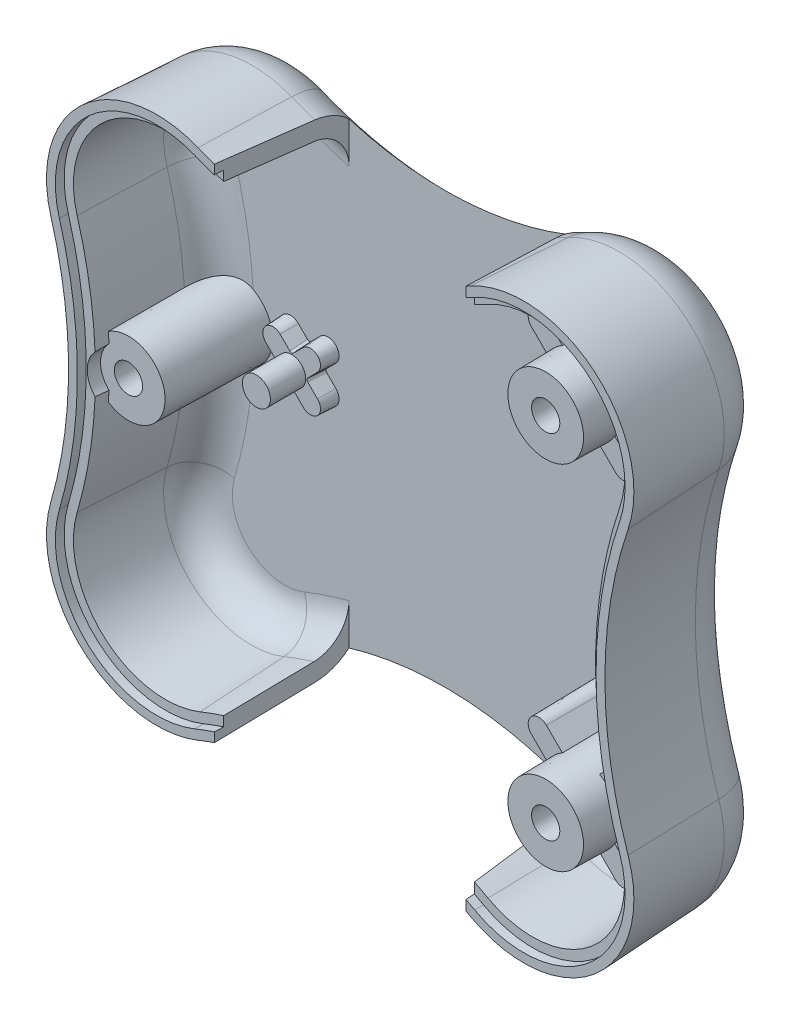
from build123d import *

# Parameters (mm, degrees)
BOSS_EXTRUDE1_DEPTH           = 16.5
BOSS_EXTRUDE1_DRAFT           = -3
FILLET1_R                     = 6
SHELL1_T                      = -2
SKETCH3_W                     = 27
SKETCH3_H                     = 29
CUT_EXTRUDE1_DEPTH            = 55.25
SKETCH4_R                     = 4.5
BOSS_EXTRUDE2_DEPTH           = 12
BOSS_EXTRUDE2_DRAFT           = 1
BOSS_EXTRUDE2_PROFILE_2_DEPTH = 12
BOSS_EXTRUDE2_PROFILE_2_DRAFT = 1
BOSS_EXTRUDE9_REACH           = 50.588
SKETCH16_R                    = 4.15
BOSS_EXTRUDE9_DRAFT           = 1
BOSS_EXTRUDE3_DEPTH           = 8
BOSS_EXTRUDE3_DRAFT           = 1
CIRPATTERN1_COPY_1_DEPTH      = 8
CIRPATTERN1_COPY_1_DRAFT      = 1
CIRPATTERN1_COPY_2_DEPTH      = 8
CIRPATTERN1_COPY_2_DRAFT      = 1
CIRPATTERN1_COPY_3_DEPTH      = 8
CIRPATTERN1_COPY_3_DRAFT      = 1
MIRROR1_COPY_1_DEPTH          = 8
MIRROR1_COPY_1_DRAFT          = 1
MIRROR1_COPY_2_DEPTH          = 8
MIRROR1_COPY_2_DRAFT          = 1
MIRROR1_COPY_3_DEPTH          = 8
MIRROR1_COPY_3_DRAFT          = 1
MIRROR1_COPY_4_DEPTH          = 8
MIRROR1_COPY_4_DRAFT          = 1
SKETCH17_R                    = 3.75
CUT_EXTRUDE7_DEPTH            = 11
CUT_EXTRUDE7_DRAFT            = -3
CUT_EXTRUDE7_PROFILE_2_DEPTH  = 11
CUT_EXTRUDE7_PROFILE_2_DRAFT  = -3
CUT_EXTRUDE7_PROFILE_3_DEPTH  = 11
CUT_EXTRUDE7_PROFILE_3_DRAFT  = -3
SKETCH18_R                    = 1.6
CUT_EXTRUDE8_DEPTH            = 11
CUT_EXTRUDE9_DEPTH            = 1
SKETCH19_R                    = 3.175
CUT_EXTRUDE10_DEPTH           = 3
SKETCH10_R                    = 1.5875
BOSS_EXTRUDE6_DEPTH           = 6
SKETCH11_W                    = 27
SKETCH11_H                    = 80.821969152
CUT_EXTRUDE5_DEPTH            = 49.734693521
CUT_EXTRUDE5_DRAFT            = -3
BOSS_EXTRUDE7_DEPTH           = 2
BOSS_EXTRUDE7_TAPER           = 3
CIRPATTERN2_COUNT             = 4
FILLET3_R                     = 0.3


with BuildPart() as part:
    # Sketch2 → Boss-Extrude1 (with draft: the straight prism first)
    with BuildSketch(Plane.XY):
        with BuildLine():
            ThreePointArc((32.637919282, -16), (30.008796412, 0), (32.637919282, 16))
            ThreePointArc((32.637919282, 16), (28.812030199, 29.590643021), (14.758307371, 30.945589403))
            ThreePointArc((14.758307371, 30.945589403), (-0.467881352, 26.53374904), (-16.112917371, 29.0899193))
            ThreePointArc((-16.112917371, 29.0899193), (-29.180524263, 26.770185381), (-32.7952, 14))
            ThreePointArc((-32.7952, 14), (-30.7952, 0), (-32.7952, -14))
            ThreePointArc((-32.7952, -14), (-29.180524263, -26.770185381), (-16.112917371, -29.0899193))
            ThreePointArc((-16.112917371, -29.0899193), (-0.467881352, -26.53374904), (14.758307371, -30.945589403))
            ThreePointArc((14.758307371, -30.945589403), (28.812030199, -29.590643021), (32.637919282, -16))
        make_face()
    extrude(amount=-BOSS_EXTRUDE1_DEPTH)
    # Boss-Extrude1: the draft: its side faces are tilted about the plane it starts from
    boss_extrude1_sides = [part.faces().sort_by_distance(p)[0] for p in [
        (-0.467881352, -26.53374904, -8.25),
        (28.812030199, -29.590643021, -8.25),
        (30.008796412, 0, -8.25),
        (28.812030199, 29.590643021, -8.25),
        (-0.467881352, 26.53374904, -8.25),
        (-29.180524263, 26.770185381, -8.25),
        (-30.7952, 0, -8.25),
        (-29.180524263, -26.770185381, -8.25),
    ]]
    draft(boss_extrude1_sides, Plane.XY, BOSS_EXTRUDE1_DRAFT)

    # Fillet1
    fillet1_edges = [part.edges().sort_by_distance(p)[0] for p in [
        (-0.415996161, 25.670578685, -16.5),
        (-28.600442049, 26.128890006, -16.5),
        (-29.930471642, 0, -16.5),
        (-28.600442049, -26.128890006, -16.5),
        (-0.415996161, -25.670578685, -16.5),
        (28.257439765, -28.927178942, -16.5),
        (29.144068053, 0, -16.5),
        (28.257439765, 28.927178942, -16.5),
    ]]
    fillet(fillet1_edges, radius=FILLET1_R)

    # Shell1
    shell1_openings = [part.faces().sort_by_distance(p)[0] for p in [
        (0.470160024, 0, 0),
    ]]
    offset(amount=SHELL1_T, openings=shell1_openings, kind=Kind.INTERSECTION)

    # Sketch3 → Cut-Extrude1 (cut, symmetric)
    with BuildSketch(Plane(origin=(0, 0, 0), x_dir=(1, 0, 0), z_dir=(0, 1, 0))):
        Rectangle(SKETCH3_W, SKETCH3_H)
    extrude(amount=CUT_EXTRUDE1_DEPTH, both=True, mode=Mode.SUBTRACT)


with BuildPart() as boss_extrude2_tool:
    # Sketch4 → Boss-Extrude2 (with draft: the straight prism first)
    with BuildSketch(Plane.XY.offset(-14.5)):
        with Locations((20.7952, 20)):
            Circle(SKETCH4_R)
    extrude(amount=BOSS_EXTRUDE2_DEPTH)
    # Boss-Extrude2: the draft: its side faces are tilted about the plane it starts from
    boss_extrude2_sides = [boss_extrude2_tool.faces().sort_by_distance(p)[0] for p in [
        (16.2952, 20, -8.5),
    ]]
    draft(boss_extrude2_sides, Plane.XY.offset(-14.5), BOSS_EXTRUDE2_DRAFT)


with BuildPart() as part_1:
    add(part.part)

    # Boss-Extrude2: add boss_extrude2_tool
    add(boss_extrude2_tool.part)


with BuildPart() as boss_extrude2_profile_2_tool:
    # Sketch4 → Boss-Extrude2 profile 2 (with draft: the straight prism first)
    with BuildSketch(Plane.XY.offset(-14.5)):
        with Locations((20.7952, -20)):
            Circle(SKETCH4_R)
    extrude(amount=BOSS_EXTRUDE2_PROFILE_2_DEPTH)
    # Boss-Extrude2 profile 2: the draft: its side faces are tilted about the plane it starts from
    boss_extrude2_profile_2_sides = [boss_extrude2_profile_2_tool.faces().sort_by_distance(p)[0] for p in [
        (16.2952, -20, -8.5),
    ]]
    draft(boss_extrude2_profile_2_sides, Plane.XY.offset(-14.5), BOSS_EXTRUDE2_PROFILE_2_DRAFT)


with BuildPart() as part_2:
    add(part_1.part)

    # Boss-Extrude2 profile 2: add boss_extrude2_profile_2_tool
    add(boss_extrude2_profile_2_tool.part)




with BuildPart() as boss_extrude9_long_prism_1:
    # Sketch16 → Boss-Extrude9 (the long prism of profile 1, to be tilted and cut off)
    with BuildSketch(Plane.XY.offset(-2.5)):
        with Locations((-26.5, 0)):
            Circle(SKETCH16_R)
    extrude(amount=-BOSS_EXTRUDE9_REACH)
    boss_extrude9_tool1_sides = [boss_extrude9_long_prism_1.faces().sort_by_distance(p)[0] for p in [
        (-30.65, 0, -27.794),
    ]]
    draft(boss_extrude9_tool1_sides, Plane.XY.offset(-2.5), BOSS_EXTRUDE9_DRAFT)  # the draft: side faces tilted about the start plane


with BuildPart() as part_3:
    add(part_2.part)
    boss_extrude9_tool1 = boss_extrude9_long_prism_1.part - part_2.part
    add(boss_extrude9_tool1.solids().sort_by_distance((-26.5, 0, -2.5))[0])


with BuildPart() as boss_extrude3_tool:
    # Sketch6 → Boss-Extrude3 (with draft: the straight prism first)
    with BuildSketch(Plane.XY.offset(-14.5)):
        with BuildLine():
            ThreePointArc((21.749794155, -20.954594155), (21.749794155, -19.045405845), (19.840605845, -19.045405845))
            Line((19.840605845, -19.045405845), (15.067635072, -23.818376618))
            ThreePointArc((15.067635072, -23.818376618), (15.067635072, -25.727564928), (16.976823382, -25.727564928))
            Line((16.976823382, -25.727564928), (21.749794155, -20.954594155))
        make_face()
    extrude(amount=BOSS_EXTRUDE3_DEPTH)
    # Boss-Extrude3: the draft: its side faces are tilted about the plane it starts from
    boss_extrude3_sides = [boss_extrude3_tool.faces().sort_by_distance(p)[0] for p in [
        (15.067635072, -25.727564928, -10.5),
        (19.363308768, -23.341079541, -10.5),
        (21.749794155, -19.045405845, -10.5),
        (17.454120459, -21.431891232, -10.5),
    ]]
    draft(boss_extrude3_sides, Plane.XY.offset(-14.5), BOSS_EXTRUDE3_DRAFT)


with BuildPart() as part_4:
    add(part_3.part)

    # Boss-Extrude3: add boss_extrude3_tool
    add(boss_extrude3_tool.part)


with BuildPart() as cirpattern1_copy_1_tool:
    # CirPattern1 copy 1 sketch → CirPattern1 copy 1 (with draft: the straight prism first)
    with BuildSketch(Plane(origin=(0.7952, -40.7952, -14.5), x_dir=(0, 1, 0), z_dir=(0, 0, 1))):
        with BuildLine():
            ThreePointArc((21.749794155, -20.954594155), (21.749794155, -19.045405845), (19.840605845, -19.045405845))
            Line((19.840605845, -19.045405845), (15.067635072, -23.818376618))
            ThreePointArc((15.067635072, -23.818376618), (15.067635072, -25.727564928), (16.976823382, -25.727564928))
            Line((16.976823382, -25.727564928), (21.749794155, -20.954594155))
        make_face()
    extrude(amount=CIRPATTERN1_COPY_1_DEPTH)
    # CirPattern1 copy 1: the draft: its side faces are tilted about the plane it starts from
    cirpattern1_copy_1_sides = [cirpattern1_copy_1_tool.faces().sort_by_distance(p)[0] for p in [
        (26.522764928, -25.727564928, -10.5),
        (24.136279541, -21.431891232, -10.5),
        (19.840605845, -19.045405845, -10.5),
        (22.227091232, -23.341079541, -10.5),
    ]]
    draft(cirpattern1_copy_1_sides, Plane(origin=(0.7952, -40.7952, -14.5), x_dir=(0, 1, 0), z_dir=(0, 0, 1)), CIRPATTERN1_COPY_1_DRAFT)


with BuildPart() as part_5:
    add(part_4.part)

    # CirPattern1 copy 1: add cirpattern1_copy_1_tool
    add(cirpattern1_copy_1_tool.part)


with BuildPart() as cirpattern1_copy_2_tool:
    # CirPattern1 copy 2 sketch → CirPattern1 copy 2 (with draft: the straight prism first)
    with BuildSketch(Plane(origin=(41.5904, -40, -14.5), x_dir=(-1, 0, 0), z_dir=(0, 0, 1))):
        with BuildLine():
            ThreePointArc((21.749794155, -20.954594155), (21.749794155, -19.045405845), (19.840605845, -19.045405845))
            Line((19.840605845, -19.045405845), (15.067635072, -23.818376618))
            ThreePointArc((15.067635072, -23.818376618), (15.067635072, -25.727564928), (16.976823382, -25.727564928))
            Line((16.976823382, -25.727564928), (21.749794155, -20.954594155))
        make_face()
    extrude(amount=CIRPATTERN1_COPY_2_DEPTH)
    # CirPattern1 copy 2: the draft: its side faces are tilted about the plane it starts from
    cirpattern1_copy_2_sides = [cirpattern1_copy_2_tool.faces().sort_by_distance(p)[0] for p in [
        (26.522764928, -14.272435072, -10.5),
        (22.227091232, -16.658920459, -10.5),
        (19.840605845, -20.954594155, -10.5),
        (24.136279541, -18.568108768, -10.5),
    ]]
    draft(cirpattern1_copy_2_sides, Plane(origin=(41.5904, -40, -14.5), x_dir=(-1, 0, 0), z_dir=(0, 0, 1)), CIRPATTERN1_COPY_2_DRAFT)


with BuildPart() as part_6:
    add(part_5.part)

    # CirPattern1 copy 2: add cirpattern1_copy_2_tool
    add(cirpattern1_copy_2_tool.part)


with BuildPart() as cirpattern1_copy_3_tool:
    # CirPattern1 copy 3 sketch → CirPattern1 copy 3 (with draft: the straight prism first)
    with BuildSketch(Plane(origin=(40.7952, 0.7952, -14.5), x_dir=(0, -1, 0), z_dir=(0, 0, 1))):
        with BuildLine():
            ThreePointArc((21.749794155, -20.954594155), (21.749794155, -19.045405845), (19.840605845, -19.045405845))
            Line((19.840605845, -19.045405845), (15.067635072, -23.818376618))
            ThreePointArc((15.067635072, -23.818376618), (15.067635072, -25.727564928), (16.976823382, -25.727564928))
            Line((16.976823382, -25.727564928), (21.749794155, -20.954594155))
        make_face()
    extrude(amount=CIRPATTERN1_COPY_3_DEPTH)
    # CirPattern1 copy 3: the draft: its side faces are tilted about the plane it starts from
    cirpattern1_copy_3_sides = [cirpattern1_copy_3_tool.faces().sort_by_distance(p)[0] for p in [
        (15.067635072, -14.272435072, -10.5),
        (17.454120459, -18.568108768, -10.5),
        (21.749794155, -20.954594155, -10.5),
        (19.363308768, -16.658920459, -10.5),
    ]]
    draft(cirpattern1_copy_3_sides, Plane(origin=(40.7952, 0.7952, -14.5), x_dir=(0, -1, 0), z_dir=(0, 0, 1)), CIRPATTERN1_COPY_3_DRAFT)


with BuildPart() as part_7:
    add(part_6.part)

    # CirPattern1 copy 3: add cirpattern1_copy_3_tool
    add(cirpattern1_copy_3_tool.part)


with BuildPart() as mirror1_copy_1_tool:
    # Mirror1 copy 1 sketch → Mirror1 copy 1 (with draft: the straight prism first)
    with BuildSketch(Plane.XY.offset(-14.5)):
        with BuildLine():
            ThreePointArc((21.749794155, 20.954594155), (21.749794155, 19.045405845), (19.840605845, 19.045405845))
            Line((19.840605845, 19.045405845), (15.067635072, 23.818376618))
            ThreePointArc((15.067635072, 23.818376618), (15.067635072, 25.727564928), (16.976823382, 25.727564928))
            Line((16.976823382, 25.727564928), (21.749794155, 20.954594155))
        make_face()
    extrude(amount=MIRROR1_COPY_1_DEPTH)
    # Mirror1 copy 1: the draft: its side faces are tilted about the plane it starts from
    mirror1_copy_1_sides = [mirror1_copy_1_tool.faces().sort_by_distance(p)[0] for p in [
        (15.067635072, 25.727564928, -10.5),
        (19.363308768, 23.341079541, -10.5),
        (21.749794155, 19.045405845, -10.5),
        (17.454120459, 21.431891232, -10.5),
    ]]
    draft(mirror1_copy_1_sides, Plane.XY.offset(-14.5), MIRROR1_COPY_1_DRAFT)


with BuildPart() as part_8:
    add(part_7.part)

    # Mirror1 copy 1: add mirror1_copy_1_tool
    add(mirror1_copy_1_tool.part)


with BuildPart() as mirror1_copy_2_tool:
    # Mirror1 copy 2 sketch → Mirror1 copy 2 (with draft: the straight prism first)
    with BuildSketch(Plane(origin=(0.7952, 40.7952, -14.5), x_dir=(0, -1, 0), z_dir=(0, 0, 1))):
        with BuildLine():
            ThreePointArc((21.749794155, 20.954594155), (21.749794155, 19.045405845), (19.840605845, 19.045405845))
            Line((19.840605845, 19.045405845), (15.067635072, 23.818376618))
            ThreePointArc((15.067635072, 23.818376618), (15.067635072, 25.727564928), (16.976823382, 25.727564928))
            Line((16.976823382, 25.727564928), (21.749794155, 20.954594155))
        make_face()
    extrude(amount=MIRROR1_COPY_2_DEPTH)
    # Mirror1 copy 2: the draft: its side faces are tilted about the plane it starts from
    mirror1_copy_2_sides = [mirror1_copy_2_tool.faces().sort_by_distance(p)[0] for p in [
        (26.522764928, 25.727564928, -10.5),
        (24.136279541, 21.431891232, -10.5),
        (19.840605845, 19.045405845, -10.5),
        (22.227091232, 23.341079541, -10.5),
    ]]
    draft(mirror1_copy_2_sides, Plane(origin=(0.7952, 40.7952, -14.5), x_dir=(0, -1, 0), z_dir=(0, 0, 1)), MIRROR1_COPY_2_DRAFT)


with BuildPart() as part_9:
    add(part_8.part)

    # Mirror1 copy 2: add mirror1_copy_2_tool
    add(mirror1_copy_2_tool.part)


with BuildPart() as mirror1_copy_3_tool:
    # Mirror1 copy 3 sketch → Mirror1 copy 3 (with draft: the straight prism first)
    with BuildSketch(Plane(origin=(41.5904, 40, -14.5), x_dir=(-1, 0, 0), z_dir=(0, 0, 1))):
        with BuildLine():
            ThreePointArc((21.749794155, 20.954594155), (21.749794155, 19.045405845), (19.840605845, 19.045405845))
            Line((19.840605845, 19.045405845), (15.067635072, 23.818376618))
            ThreePointArc((15.067635072, 23.818376618), (15.067635072, 25.727564928), (16.976823382, 25.727564928))
            Line((16.976823382, 25.727564928), (21.749794155, 20.954594155))
        make_face()
    extrude(amount=MIRROR1_COPY_3_DEPTH)
    # Mirror1 copy 3: the draft: its side faces are tilted about the plane it starts from
    mirror1_copy_3_sides = [mirror1_copy_3_tool.faces().sort_by_distance(p)[0] for p in [
        (26.522764928, 14.272435072, -10.5),
        (22.227091232, 16.658920459, -10.5),
        (19.840605845, 20.954594155, -10.5),
        (24.136279541, 18.568108768, -10.5),
    ]]
    draft(mirror1_copy_3_sides, Plane(origin=(41.5904, 40, -14.5), x_dir=(-1, 0, 0), z_dir=(0, 0, 1)), MIRROR1_COPY_3_DRAFT)


with BuildPart() as part_10:
    add(part_9.part)

    # Mirror1 copy 3: add mirror1_copy_3_tool
    add(mirror1_copy_3_tool.part)


with BuildPart() as mirror1_copy_4_tool:
    # Mirror1 copy 4 sketch → Mirror1 copy 4 (with draft: the straight prism first)
    with BuildSketch(Plane(origin=(40.7952, -0.7952, -14.5), x_dir=(0, 1, 0), z_dir=(0, 0, 1))):
        with BuildLine():
            ThreePointArc((21.749794155, 20.954594155), (21.749794155, 19.045405845), (19.840605845, 19.045405845))
            Line((19.840605845, 19.045405845), (15.067635072, 23.818376618))
            ThreePointArc((15.067635072, 23.818376618), (15.067635072, 25.727564928), (16.976823382, 25.727564928))
            Line((16.976823382, 25.727564928), (21.749794155, 20.954594155))
        make_face()
    extrude(amount=MIRROR1_COPY_4_DEPTH)
    # Mirror1 copy 4: the draft: its side faces are tilted about the plane it starts from
    mirror1_copy_4_sides = [mirror1_copy_4_tool.faces().sort_by_distance(p)[0] for p in [
        (15.067635072, 14.272435072, -10.5),
        (17.454120459, 18.568108768, -10.5),
        (21.749794155, 20.954594155, -10.5),
        (19.363308768, 16.658920459, -10.5),
    ]]
    draft(mirror1_copy_4_sides, Plane(origin=(40.7952, -0.7952, -14.5), x_dir=(0, 1, 0), z_dir=(0, 0, 1)), MIRROR1_COPY_4_DRAFT)


with BuildPart() as part_11:
    add(part_10.part)

    # Mirror1 copy 4: add mirror1_copy_4_tool
    add(mirror1_copy_4_tool.part)


with BuildPart() as cut_extrude7_tool:
    # Sketch17 → Cut-Extrude7 (with draft: the straight prism first)
    with BuildSketch(Plane(origin=(0, 0, -16.5), x_dir=(-1, 0, 0), z_dir=(0, 0, -1))):
        with Locations((-20.7952, 20)):
            Circle(SKETCH17_R)
    extrude(amount=-CUT_EXTRUDE7_DEPTH)
    # Cut-Extrude7: the draft: its side faces are tilted about the plane it starts from
    cut_extrude7_sides = [cut_extrude7_tool.faces().sort_by_distance(p)[0] for p in [
        (24.5452, 20, -11),
    ]]
    draft(cut_extrude7_sides, Plane(origin=(0, 0, -16.5), x_dir=(-1, 0, 0), z_dir=(0, 0, -1)), CUT_EXTRUDE7_DRAFT)


with BuildPart() as part_12:
    add(part_11.part)

    # Cut-Extrude7: cut by cut_extrude7_tool
    add(cut_extrude7_tool.part, mode=Mode.SUBTRACT)


with BuildPart() as cut_extrude7_profile_2_tool:
    # Sketch17 → Cut-Extrude7 profile 2 (with draft: the straight prism first)
    with BuildSketch(Plane(origin=(0, 0, -16.5), x_dir=(-1, 0, 0), z_dir=(0, 0, -1))):
        with Locations((-20.7952, -20)):
            Circle(SKETCH17_R)
    extrude(amount=-CUT_EXTRUDE7_PROFILE_2_DEPTH)
    # Cut-Extrude7 profile 2: the draft: its side faces are tilted about the plane it starts from
    cut_extrude7_profile_2_sides = [cut_extrude7_profile_2_tool.faces().sort_by_distance(p)[0] for p in [
        (24.5452, -20, -11),
    ]]
    draft(cut_extrude7_profile_2_sides, Plane(origin=(0, 0, -16.5), x_dir=(-1, 0, 0), z_dir=(0, 0, -1)), CUT_EXTRUDE7_PROFILE_2_DRAFT)


with BuildPart() as part_13:
    add(part_12.part)

    # Cut-Extrude7 profile 2: cut by cut_extrude7_profile_2_tool
    add(cut_extrude7_profile_2_tool.part, mode=Mode.SUBTRACT)


with BuildPart() as cut_extrude7_profile_3_tool:
    # Sketch17 → Cut-Extrude7 profile 3 (with draft: the straight prism first)
    with BuildSketch(Plane(origin=(0, 0, -16.5), x_dir=(-1, 0, 0), z_dir=(0, 0, -1))):
        with Locations((26.5, 0)):
            Circle(SKETCH17_R)
    extrude(amount=-CUT_EXTRUDE7_PROFILE_3_DEPTH)
    # Cut-Extrude7 profile 3: the draft: its side faces are tilted about the plane it starts from
    cut_extrude7_profile_3_sides = [cut_extrude7_profile_3_tool.faces().sort_by_distance(p)[0] for p in [
        (-22.75, 0, -11),
    ]]
    draft(cut_extrude7_profile_3_sides, Plane(origin=(0, 0, -16.5), x_dir=(-1, 0, 0), z_dir=(0, 0, -1)), CUT_EXTRUDE7_PROFILE_3_DRAFT)


with BuildPart() as part_14:
    add(part_13.part)

    # Cut-Extrude7 profile 3: cut by cut_extrude7_profile_3_tool
    add(cut_extrude7_profile_3_tool.part, mode=Mode.SUBTRACT)

    # Sketch18 → Cut-Extrude8 (cut)
    with BuildSketch(Plane(origin=(0, 0, -5.5), x_dir=(-1, 0, 0), z_dir=(0, 0, -1))):
        with Locations((-20.7952, 20)):
            Circle(SKETCH18_R)
        with Locations((-20.7952, -20)):
            Circle(SKETCH18_R)
        with Locations((26.5, 0)):
            Circle(SKETCH18_R)
    extrude(amount=-CUT_EXTRUDE8_DEPTH, mode=Mode.SUBTRACT)

    # Sketch7 → Cut-Extrude9 (cut)
    with BuildSketch(Plane.XY):
        with BuildLine():
            ThreePointArc((-13.213913911, 27.012711921), (-12.541796081, 25.768421913), (-13.786086089, 25.096304083))
            ThreePointArc((-13.786086089, 25.096304083), (-15.526074609, 25.660568466), (-17.237693316, 26.305793807))
            ThreePointArc((-17.237693316, 26.305793807), (-27.16620523, 24.543305385), (-29.912565096, 14.840768514))
            ThreePointArc((-29.912565096, 14.840768514), (-27.792455308, 0), (-29.912565096, -14.840768514))
            ThreePointArc((-29.912565096, -14.840768514), (-27.16620523, -24.543305385), (-17.237693316, -26.305793807))
            ThreePointArc((-17.237693316, -26.305793807), (-15.232541742, -25.559021074), (-13.189454902, -24.923333642))
            ThreePointArc((-13.189454902, -24.923333642), (-11.956027226, -25.615183458), (-12.647877042, -26.848611134))
            ThreePointArc((-12.647877042, -26.848611134), (-14.586197571, -27.451701505), (-16.488528095, -28.160180895))
            ThreePointArc((-16.488528095, -28.160180895), (-28.507857112, -26.026535046), (-31.832565096, -14.280768514))
            ThreePointArc((-31.832565096, -14.280768514), (-29.792455308, 0), (-31.832565096, 14.280768514))
            ThreePointArc((-31.832565096, 14.280768514), (-28.507857112, 26.026535046), (-16.488528095, 28.160180895))
            ThreePointArc((-16.488528095, 28.160180895), (-14.864678529, 27.548041704), (-13.213913911, 27.012711921))
        make_face()
        with BuildLine():
            ThreePointArc((13.92438891, 27.152681135), (15.075999783, 27.715692942), (16.208487155, 28.316244565))
            ThreePointArc((16.208487155, 28.316244565), (26.886230653, 27.286782827), (29.793066285, 16.960878301))
            ThreePointArc((29.793066285, 16.960878301), (27.00605172, 0), (29.793066285, -16.960878301))
            ThreePointArc((29.793066285, -16.960878301), (26.886230653, -27.286782827), (16.208487155, -28.316244565))
            ThreePointArc((16.208487155, -28.316244565), (14.694582136, -27.524013118), (13.147431441, -26.798848448))
            ThreePointArc((13.147431441, -26.798848448), (11.828411109, -27.308932129), (12.33849479, -28.627952462))
            ThreePointArc((12.33849479, -28.627952462), (13.806310007, -29.315931818), (15.242584334, -30.067538869))
            ThreePointArc((15.242584334, -30.067538869), (28.168923484, -28.821285711), (31.68790137, -16.320878301))
            ThreePointArc((31.68790137, -16.320878301), (29.00605172, 0), (31.68790137, 16.320878301))
            ThreePointArc((31.68790137, 16.320878301), (28.168923484, 28.821285711), (15.242584334, 30.067538869))
            ThreePointArc((15.242584334, 30.067538869), (14.168169151, 29.497782598), (13.07561109, 28.96364116))
            ThreePointArc((13.07561109, 28.96364116), (12.594519988, 27.633772237), (13.92438891, 27.152681135))
        make_face()
    extrude(amount=-CUT_EXTRUDE9_DEPTH, mode=Mode.SUBTRACT)

    # Sketch19 → Cut-Extrude10 (cut)
    with BuildSketch(Plane.XY.offset(-2.5)):
        with Locations((-26.5, 0)):
            Circle(SKETCH19_R)
    extrude(amount=CUT_EXTRUDE10_DEPTH, mode=Mode.SUBTRACT)

    # Sketch10 → Boss-Extrude6 (add)
    with BuildSketch(Plane.XY.offset(-14.5)):
        with Locations((-18, 0)):
            Circle(SKETCH10_R)
    extrude(amount=BOSS_EXTRUDE6_DEPTH)


with BuildPart() as cut_extrude5_tool:
    # Sketch11 → Cut-Extrude5 (with draft: the straight prism first)
    with BuildSketch(Plane.XY.offset(-14.5)):
        with Locations((0, -5.474721423)):
            Rectangle(SKETCH11_W, SKETCH11_H)
    extrude(amount=CUT_EXTRUDE5_DEPTH)
    # Cut-Extrude5: the draft: its side faces are tilted about the plane it starts from
    cut_extrude5_sides = [cut_extrude5_tool.faces().sort_by_distance(p)[0] for p in [
        (-13.5, -5.474721423, 10.367346761),
        (0, -45.885705999, 10.367346761),
        (13.5, -5.474721423, 10.367346761),
        (0, 34.936263153, 10.367346761),
    ]]
    draft(cut_extrude5_sides, Plane.XY.offset(-14.5), CUT_EXTRUDE5_DRAFT)


with BuildPart() as part_15:
    add(part_14.part)

    # Cut-Extrude5: cut by cut_extrude5_tool
    add(cut_extrude5_tool.part, mode=Mode.SUBTRACT)

    # Sketch12 → Boss-Extrude7 (add)
    with BuildSketch(Plane.XY.offset(-14.5)):
        with BuildLine():
            ThreePointArc((-18.883883476, 0.883883476), (-18.883883476, -0.883883476), (-17.116116524, -0.883883476))
            Line((-17.116116524, -0.883883476), (-14.99479618, 1.237436867))
            ThreePointArc((-14.99479618, 1.237436867), (-14.99479618, 3.00520382), (-16.762563133, 3.00520382))
            Line((-16.762563133, 3.00520382), (-18.883883476, 0.883883476))
        make_face()
    boss_extrude7 = extrude(amount=BOSS_EXTRUDE7_DEPTH, taper=BOSS_EXTRUDE7_TAPER)

    # CirPattern2: Boss-Extrude7 ×4 about axis
    cirpattern2_axis = Axis((-18, 0, 0), (0, 0, 1))
    for i in range(1, CIRPATTERN2_COUNT):
        add(boss_extrude7.rotate(cirpattern2_axis, i * 360 / CIRPATTERN2_COUNT))

    # Fillet3
    fillet3_edges = [part_15.edges().sort_by_distance(p)[0] for p in [
        (-16.306348839, 0, -13.5),
        (-18, 1.693651161, -13.5),
        (-19.693651161, 0, -13.5),
        (-18, -1.693651161, -13.5),
    ]]
    fillet(fillet3_edges, radius=FILLET3_R)


solid = part_15.part
